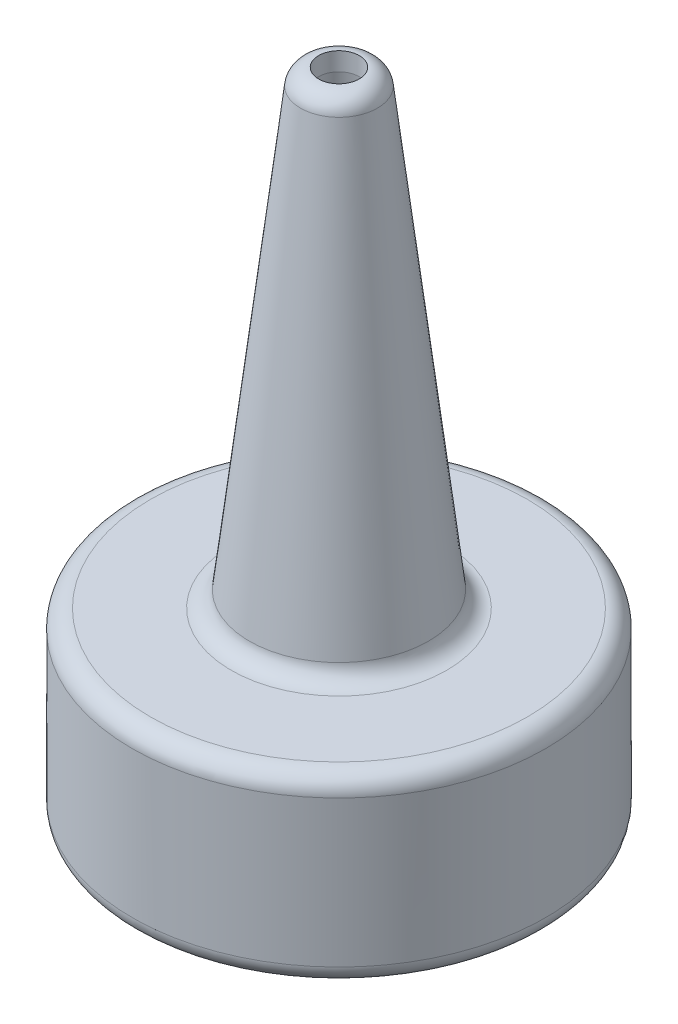
from build123d import *

# Parameters (mm, degrees)
FILLET1_R = 1.27


with BuildPart() as part:
    # Sketch1 → Revolve1 (revolve)
    with BuildSketch(Plane.XY, mode=Mode.PRIVATE) as revolve1_sk:
        Polygon((13.081, 0), (14.351, 0), (14.351, 12.7), (6.35, 12.7), (2.54, 45.212), (1.410137462, 45.212), (1.410137462, 43.942), (5.220137462, 11.43), (13.081, 11.43), (13.081, 1.27), align=None)
    revolve(revolve1_sk.sketch.rotate(Axis((0, 43.942, 0), (0, -1, 0)), 180), axis=Axis((0, 43.942, 0), (0, -1, 0)))

    # Fillet1
    fillet1_edges = [part.edges().sort_by_distance(p)[0] for p in [
        (2.54, 45.212, 0),
        (6.35, 12.7, 0),
        (14.351, 12.7, 0),
        (14.351, 0, 0),
    ]]
    fillet(fillet1_edges, radius=FILLET1_R - 0.0001)  # a hair under: the kernel refuses the full size


solid = part.part
